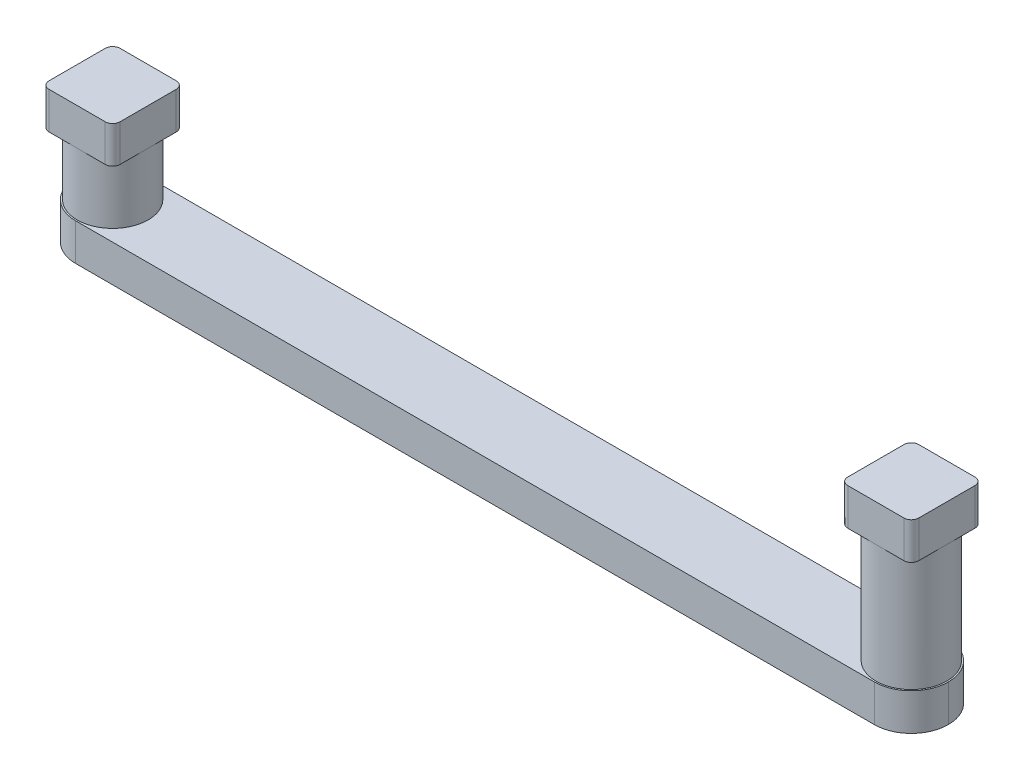
from build123d import *

# Parameters (mm, degrees)
SKETCH1_W           = 74.93
SKETCH1_H           = 6.35
BOSS_EXTRUDE1_DEPTH = 3.175
SKETCH2_R           = 3.048
BOSS_EXTRUDE2_DEPTH = 5.334
SKETCH3_W           = 6.096
SKETCH3_H           = 6.096
BOSS_EXTRUDE3_DEPTH = 3.175
SKETCH4_R           = 3.048
BOSS_EXTRUDE4_DEPTH = 10.16
SKETCH5_W           = 6.096
SKETCH5_H           = 6.096
BOSS_EXTRUDE5_DEPTH = 3.175
FILLET1_R           = 0.635
FILLET2_R           = 3.175


with BuildPart() as part:
    # Sketch1 → Boss-Extrude1 (new body)
    with BuildSketch(Plane(origin=(0, 0, 0), x_dir=(1, 0, 0), z_dir=(0, 1, 0))):
        Rectangle(SKETCH1_W, SKETCH1_H)
    extrude(amount=BOSS_EXTRUDE1_DEPTH)

    # Sketch2 → Boss-Extrude2 (add)
    with BuildSketch(Plane(origin=(0, 3.175, 0), x_dir=(1, 0, 0), z_dir=(0, 1, 0))):
        with Locations(Location((-34.29, 0, 0), (0, 0, 270))):
            Circle(SKETCH2_R)
    extrude(amount=BOSS_EXTRUDE2_DEPTH)

    # Sketch3 → Boss-Extrude3 (add)
    with BuildSketch(Plane(origin=(0, 8.509, 0), x_dir=(1, 0, 0), z_dir=(0, 1, 0))):
        with Locations((-34.29, 0)):
            Rectangle(SKETCH3_W, SKETCH3_H)
    extrude(amount=BOSS_EXTRUDE3_DEPTH)

    # Sketch4 → Boss-Extrude4 (add)
    with BuildSketch(Plane(origin=(0, 3.175, 0), x_dir=(1, 0, 0), z_dir=(0, 1, 0))):
        with Locations(Location((34.29, 0, 0), (0, 0, 270))):
            Circle(SKETCH4_R)
    extrude(amount=BOSS_EXTRUDE4_DEPTH)

    # Sketch5 → Boss-Extrude5 (add)
    with BuildSketch(Plane(origin=(0, 13.335, 0), x_dir=(1, 0, 0), z_dir=(0, 1, 0))):
        with Locations((34.29, 0)):
            Rectangle(SKETCH5_W, SKETCH5_H)
    extrude(amount=BOSS_EXTRUDE5_DEPTH)

    # Fillet1
    fillet1_edges = [part.edges().sort_by_distance(p)[0] for p in [
        (-37.338, 10.0965, -3.048),
        (-37.338, 10.0965, 3.048),
        (-31.242, 10.0965, 3.048),
        (-31.242, 10.0965, -3.048),
        (37.338, 14.9225, 3.048),
        (37.338, 14.9225, -3.048),
        (31.242, 14.9225, -3.048),
        (31.242, 14.9225, 3.048),
    ]]
    fillet(fillet1_edges, radius=FILLET1_R)

    # Fillet2
    fillet2_edges = [part.edges().sort_by_distance(p)[0] for p in [
        (-37.465, 1.5875, 3.175),
        (-37.465, 1.5875, -3.175),
        (37.465, 1.5875, -3.175),
        (37.465, 1.5875, 3.175),
    ]]
    fillet(fillet2_edges, radius=FILLET2_R - 0.0001)  # a hair under: the kernel refuses the full size


solid = part.part
